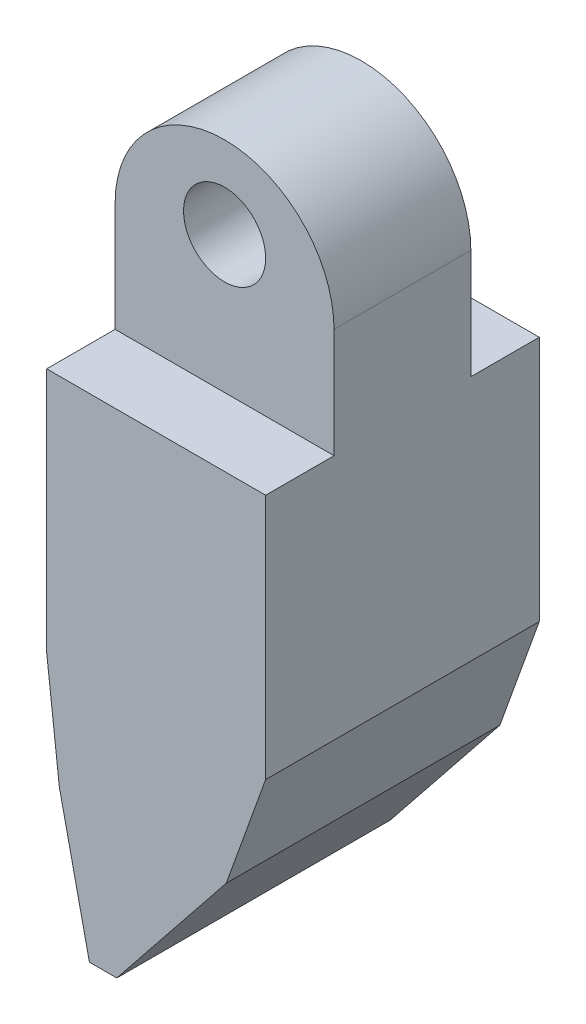
from build123d import *

# Parameters (mm, degrees)
EXTRUDE_1_DEPTH          = 50
CUT_EXTRUDE_1_DEPTH      = 123.474487139
CUT_EXTRUDE_1_DEPTH_BACK = 12.5
CUT_EXTRUDE_START        = -12.5
CUT_EXTRUDE_2_DEPTH      = 12.5
SKETCH_4_R               = 7.5
CUT_EXTRUDE_3_DEPTH      = 118.924764151


with BuildPart() as part:
    # 草图1 → 凸台-拉伸1 (new body)
    with BuildSketch(Plane.XY):
        with BuildLine():
            ThreePointArc((20, 0), (0, 20), (-20, 0))
            Line((-20, 0), (-20, -65))
            Line((-20, -65), (-17.7, -85))
            Line((-17.7, -85), (-12.2, -110))
            Line((-12.2, -110), (-7.2, -110))
            Line((-7.2, -110), (12.8, -85))
            Line((12.8, -85), (20, -65))
            Line((20, -65), (20, 0))
        make_face()
    extrude(amount=EXTRUDE_1_DEPTH)

    # 草图2 → 切除-拉伸1 (cut, two sides: drawn at the far end of the back side and taken through both)
    with BuildSketch(Plane(origin=(0, 0, 0), x_dir=(-1, 0, 0), z_dir=(0, 0, -1)).offset(-CUT_EXTRUDE_1_DEPTH_BACK)):
        with BuildLine():
            Line((20, -20), (20, 0))
            ThreePointArc((20, 0), (0, 20), (-20, 0))
            Line((-20, 0), (-20, -20))
            Line((-20, -20), (0, -20))
            Line((0, -20), (20, -20))
        make_face()
    extrude(amount=CUT_EXTRUDE_1_DEPTH + CUT_EXTRUDE_1_DEPTH_BACK, mode=Mode.SUBTRACT)

    # 草图3 → 切除-拉伸2 (cut)
    with BuildSketch(Plane.XY.offset(50).offset(CUT_EXTRUDE_START)):
        with BuildLine():
            Line((20, -20), (20, 0))
            ThreePointArc((20, 0), (0, 20), (-20, 0))
            Line((-20, 0), (-20, -20))
            Line((-20, -20), (20, -20))
        make_face()
    extrude(amount=CUT_EXTRUDE_2_DEPTH, mode=Mode.SUBTRACT)

    # 草图4 → 切除-拉伸3 (cut, through all)
    with BuildSketch(Plane(origin=(0, 0, 12.5), x_dir=(-1, 0, 0), z_dir=(0, 0, -1))):
        with Locations((0, 5)):
            Circle(SKETCH_4_R)
    extrude(amount=-CUT_EXTRUDE_3_DEPTH, mode=Mode.SUBTRACT)


solid = part.part
